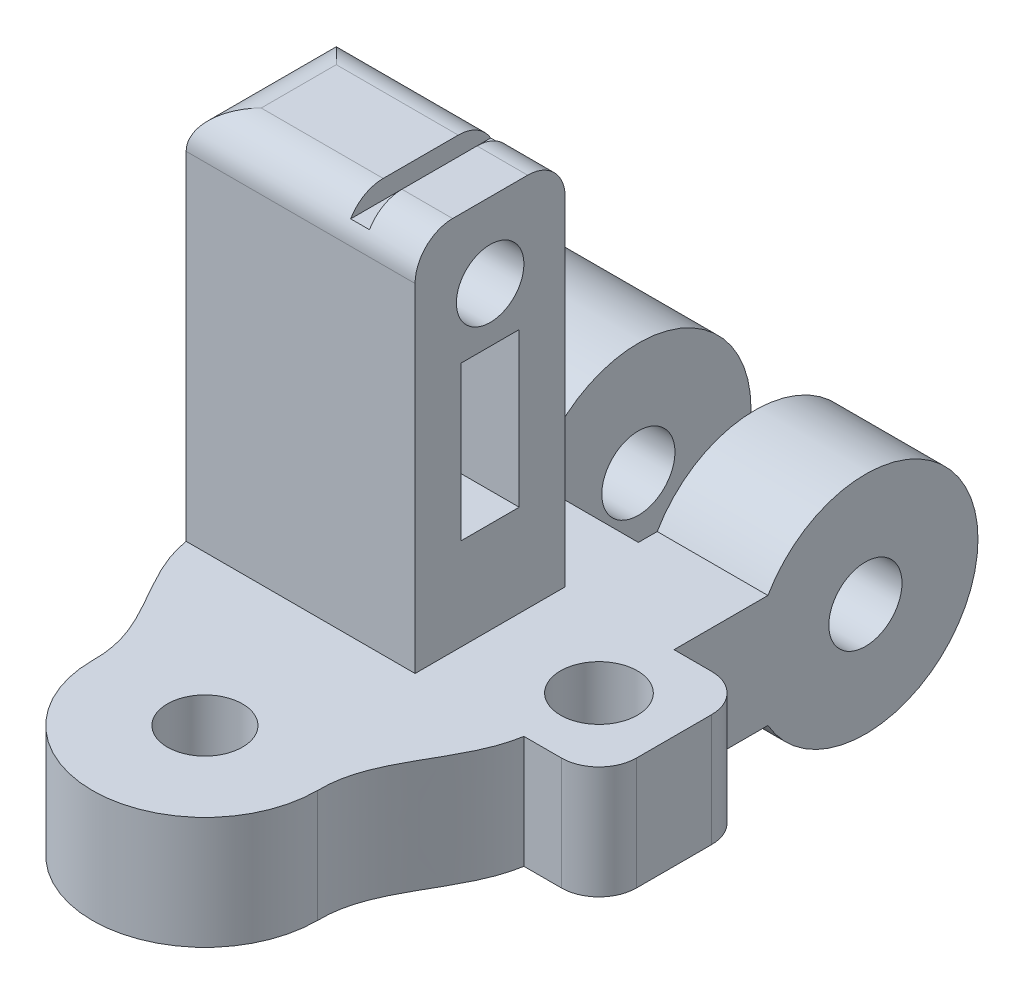
from build123d import *

# Parameters (mm, degrees)
SKETCH1_W           = 9
SKETCH1_H           = 9
BOSS_EXTRUDE1_DEPTH = 3
SKETCH2_W           = 2.95
SKETCH2_H           = 6
BOSS_EXTRUDE2_DEPTH = 6.1
FILLET1_R           = 3
SKETCH3_R           = 0.975
CUT_EXTRUDE1_DEPTH  = 11.1
CUT_EXTRUDE3_DEPTH  = 21.1
BOSS_EXTRUDE3_START = 4
SKETCH5_R           = 3
BOSS_EXTRUDE3_DEPTH = 4
SKETCH8_R           = 1.55
CUT_EXTRUDE4_DEPTH  = 5
CUT_EXTRUDE5_DEPTH  = 0.5
SKETCH10_W          = 9
SKETCH10_H          = 3
BOSS_EXTRUDE4_DEPTH = 4
SKETCH11_R          = 1
CUT_EXTRUDE6_DEPTH  = 4
CUT_EXTRUDE7_DEPTH  = 4
SKETCH13_W          = 6.1
SKETCH13_H          = 4
BOSS_EXTRUDE7_DEPTH = 7.5
SKETCH16_W          = 1.55
SKETCH16_H          = 4.1
CUT_EXTRUDE9_DEPTH  = 3.2
SKETCH17_W          = 4
SKETCH17_H          = 3
BOSS_EXTRUDE8_DEPTH = 2
SKETCH19_R          = 1.025
CUT_EXTRUDE10_DEPTH = 4
FILLET2_R           = 1
SKETCH21_W          = 6.1
SKETCH21_H          = 4
BOSS_EXTRUDE9_DEPTH = 2.5
SKETCH23_R          = 0.9
CUT_EXTRUDE11_DEPTH = 4
FILLET3_R           = 1
CUT_EXTRUDE12_DEPTH = 0.5


with BuildPart() as part:
    # Sketch1 → Boss-Extrude1 (new body)
    with BuildSketch(Plane(origin=(0, 0, 0), x_dir=(1, 0, 0), z_dir=(0, 1, 0))):
        with Locations((4.5, 4.5)):
            Rectangle(SKETCH1_W, SKETCH1_H)
    extrude(amount=BOSS_EXTRUDE1_DEPTH)

    # Sketch2 → Boss-Extrude2 (add)
    with BuildSketch(Plane(origin=(0, 0, -9), x_dir=(-1, 0, 0), z_dir=(0, 0, -1))):
        with Locations((-7.525, 1.5)):
            Rectangle(SKETCH2_W, SKETCH2_H)
        with Locations((-1.475, 1.5)):
            Rectangle(SKETCH2_W, SKETCH2_H)
    extrude(amount=BOSS_EXTRUDE2_DEPTH)

    # Fillet1
    fillet1_edges = [part.edges().sort_by_distance(p)[0] for p in [
        (1.475, 4.5, -15.1),
        (1.475, -1.5, -15.1),
        (7.525, -1.5, -15.1),
        (7.525, 4.5, -15.1),
    ]]
    fillet(fillet1_edges, radius=FILLET1_R - 0.0001)  # a hair under: the kernel refuses the full size

    # Sketch3 → Cut-Extrude1 (cut)
    with BuildSketch(Plane(origin=(9, 0, 0), x_dir=(0, 0, -1), z_dir=(1, 0, 0))):
        with Locations((12.1, 1.5)):
            Circle(SKETCH3_R)
    extrude(amount=-CUT_EXTRUDE1_DEPTH, mode=Mode.SUBTRACT)

    # Sketch6 → Cut-Extrude3 (cut)
    with BuildSketch(Plane.ZY):
        with BuildLine():
            Line((-12.1, 4.5), (-9, 4.5))
            Line((-9, 4.5), (-9, 3))
            Line((-9, 3), (-9.501923789, 3))
            ThreePointArc((-9.501923789, 3), (-10.6, 4.098076211), (-12.1, 4.5))
        make_face()
        with BuildLine():
            Line((-12.1, -1.5), (-9, -1.5))
            Line((-9, -1.5), (-9, 0))
            Line((-9, 0), (-9.501923789, 0))
            ThreePointArc((-9.501923789, 0), (-10.6, -1.098076211), (-12.1, -1.5))
        make_face()
    extrude(amount=-CUT_EXTRUDE3_DEPTH, mode=Mode.SUBTRACT)

    # Sketch5 → Boss-Extrude3 (add)
    with BuildSketch(Plane.ZY.offset(BOSS_EXTRUDE3_START)):
        with Locations((-12.1, 1.5)):
            Circle(SKETCH5_R)
    extrude(amount=-BOSS_EXTRUDE3_DEPTH)

    # Sketch8 → Cut-Extrude4 (cut)
    with BuildSketch(Plane(origin=(0, 4.5, 0), x_dir=(-1, 0, 0), z_dir=(0, -1, 0))):
        with Locations(Location((1.6, 12.1, 0), (0, 0, 270))):
            Circle(SKETCH8_R)
    extrude(amount=CUT_EXTRUDE4_DEPTH, mode=Mode.SUBTRACT)

    # Sketch9 → Cut-Extrude5 (cut)
    with BuildSketch(Plane.ZY.offset(4)):
        with BuildLine():
            Line((-11.85, 1.5), (-11.85, -0.8))
            ThreePointArc((-11.85, -0.8), (-12.1, -1.05), (-12.35, -0.8))
            Line((-12.35, -0.8), (-12.35, 0.896446609))
            Line((-12.35, 0.896446609), (-13.549568901, -0.303122292))
            ThreePointArc((-13.549568901, -0.303122292), (-13.903122292, -0.303122292), (-13.903122292, 0.050431099))
            Line((-13.903122292, 0.050431099), (-12.703553391, 1.25))
            Line((-12.703553391, 1.25), (-14.4, 1.25))
            ThreePointArc((-14.4, 1.25), (-14.65, 1.5), (-14.4, 1.75))
            Line((-14.4, 1.75), (-12.703553391, 1.75))
            Line((-12.703553391, 1.75), (-13.903122292, 2.949568901))
            ThreePointArc((-13.903122292, 2.949568901), (-13.903122292, 3.303122292), (-13.549568901, 3.303122292))
            Line((-13.549568901, 3.303122292), (-12.35, 2.103553391))
            Line((-12.35, 2.103553391), (-12.35, 3.8))
            ThreePointArc((-12.35, 3.8), (-12.1, 4.05), (-11.85, 3.8))
            Line((-11.85, 3.8), (-11.85, 1.5))
        make_face()
    extrude(amount=-CUT_EXTRUDE5_DEPTH, mode=Mode.SUBTRACT)

    # Sketch10 → Boss-Extrude4 (add)
    with BuildSketch(Plane.XY):
        with Locations((4.5, 1.5)):
            Rectangle(SKETCH10_W, SKETCH10_H)
    extrude(amount=BOSS_EXTRUDE4_DEPTH)

    # Sketch11 → Cut-Extrude6 (cut)
    with BuildSketch(Plane(origin=(0, 3, 0), x_dir=(1, 0, 0), z_dir=(0, 1, 0))):
        with Locations(Location((4.5, -1, 0), (0, 0, 270))):
            Circle(SKETCH11_R)
    extrude(amount=-CUT_EXTRUDE6_DEPTH, mode=Mode.SUBTRACT)

    # Sketch12 → Cut-Extrude7 (cut)
    with BuildSketch(Plane(origin=(0, 3, 0), x_dir=(1, 0, 0), z_dir=(0, 1, 0))):
        with BuildLine():
            add(Edge.make_bspline(
                [(1.5, -1), (1.53988428, 0.555027292), (0.235256098, 1.545486909), (0, 3)],
                knots=[0, 0, 0, 0, 1, 1, 1, 1], degree=3))
            Line((0, 3), (0, -4))
            Line((0, -4), (4.5, -4))
            ThreePointArc((4.5, -4), (2.378679656, -3.121320344), (1.5, -1))
        make_face()
        with BuildLine():
            ThreePointArc((7.5, -1), (6.621320344, -3.121320344), (4.5, -4))
            Line((4.5, -4), (9, -4))
            Line((9, -4), (9, 3))
            add(Edge.make_bspline(
                [(7.5, -1), (7.46011572, 0.555027292), (8.764743902, 1.545486909), (9, 3)],
                knots=[0, 0, 0, 0, 1, 1, 1, 1], degree=3))
        make_face()
    extrude(amount=-CUT_EXTRUDE7_DEPTH, mode=Mode.SUBTRACT)

    # Sketch13 → Boss-Extrude7 (add)
    with BuildSketch(Plane(origin=(0, 3, 0), x_dir=(1, 0, 0), z_dir=(0, 1, 0))):
        with Locations((3.05, 5)):
            Rectangle(SKETCH13_W, SKETCH13_H)
    extrude(amount=BOSS_EXTRUDE7_DEPTH)

    # Sketch16 → Cut-Extrude9 (cut)
    with BuildSketch(Plane(origin=(6.1, 0, 0), x_dir=(0, 0, -1), z_dir=(1, 0, 0))):
        with Locations((5, 7.5)):
            Rectangle(SKETCH16_W, SKETCH16_H)
    extrude(amount=-CUT_EXTRUDE9_DEPTH, mode=Mode.SUBTRACT)

    # Sketch17 → Boss-Extrude8 (add)
    with BuildSketch(Plane(origin=(9, 0, 0), x_dir=(0, 0, -1), z_dir=(1, 0, 0))):
        with Locations((5, 1.5)):
            Rectangle(SKETCH17_W, SKETCH17_H)
    extrude(amount=BOSS_EXTRUDE8_DEPTH)

    # Sketch19 → Cut-Extrude10 (cut)
    with BuildSketch(Plane(origin=(0, 3, 0), x_dir=(1, 0, 0), z_dir=(0, 1, 0))):
        with Locations(Location((9, 5, 0), (0, 0, 270))):
            Circle(SKETCH19_R)
    extrude(amount=-CUT_EXTRUDE10_DEPTH, mode=Mode.SUBTRACT)

    # Fillet2
    fillet2_edges = [part.edges().sort_by_distance(p)[0] for p in [
        (11, 1.5, -3),
        (11, 1.5, -7),
    ]]
    fillet(fillet2_edges, radius=FILLET2_R)

    # Sketch21 → Boss-Extrude9 (add)
    with BuildSketch(Plane(origin=(0, 10.5, 0), x_dir=(1, 0, 0), z_dir=(0, 1, 0))):
        with Locations((3.05, 5)):
            Rectangle(SKETCH21_W, SKETCH21_H)
    extrude(amount=BOSS_EXTRUDE9_DEPTH)

    # Sketch23 → Cut-Extrude11 (cut)
    with BuildSketch(Plane(origin=(6.1, 0, 0), x_dir=(0, 0, -1), z_dir=(1, 0, 0))):
        with Locations((5, 11)):
            Circle(SKETCH23_R)
    extrude(amount=-CUT_EXTRUDE11_DEPTH, mode=Mode.SUBTRACT)

    # Fillet3
    fillet3_edges = [part.edges().sort_by_distance(p)[0] for p in [
        (3.05, 13, -7),
        (0, 13, -5),
        (3.05, 13, -3),
    ]]
    fillet(fillet3_edges, radius=FILLET3_R)

    # Sketch24 → Cut-Extrude12 (cut)
    with BuildSketch(Plane(origin=(0, 13, 0), x_dir=(1, 0, 0), z_dir=(0, 1, 0))):
        with BuildLine():
            Line((4.25, 3), (4.25, 7))
            ThreePointArc((4.25, 7), (4.5, 7.25), (4.75, 7))
            Line((4.75, 7), (4.75, 3))
            ThreePointArc((4.75, 3), (4.5, 2.75), (4.25, 3))
        make_face()
    extrude(amount=-CUT_EXTRUDE12_DEPTH, mode=Mode.SUBTRACT)


solid = part.part
